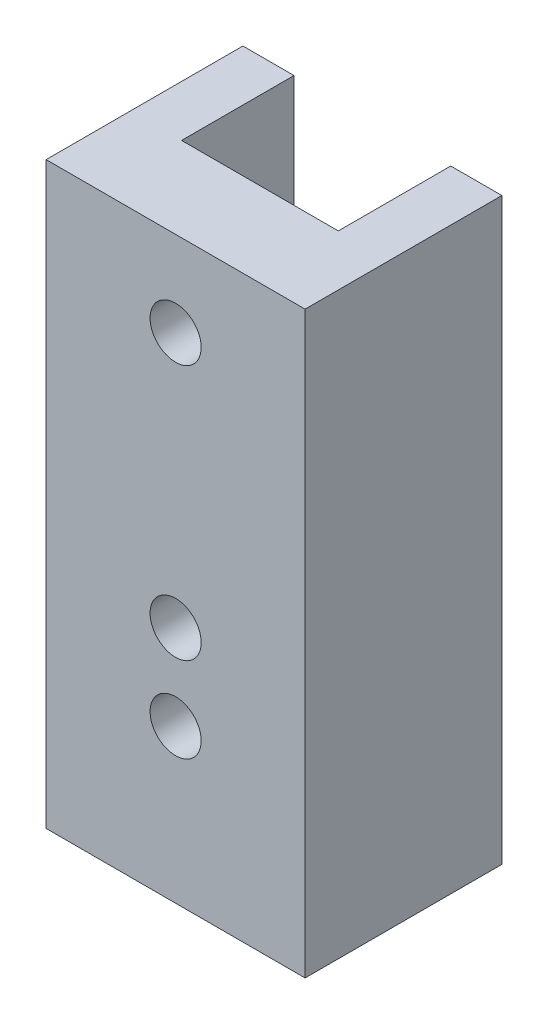
from build123d import *

# Parameters (mm, degrees)
BOSS_EXTRUDE1_DEPTH = 34
SKETCH2_R           = 1.5
CUT_EXTRUDE1_DEPTH  = 34
CUT_EXTRUDE2_DEPTH  = 10


with BuildPart() as part:
    # Sketch1 → Boss-Extrude1 (new body)
    with BuildSketch(Plane(origin=(0, 0, 0), x_dir=(1, 0, 0), z_dir=(0, 1, 0))):
        Polygon((7.6, 3.25), (4.6, 3.25), (4.6, -3.35), (-4.6, -3.35), (-4.6, 3.25), (-7.6, 3.25), (-7.6, -8.3), (0, -8.3), (7.6, -8.3), align=None)
    extrude(amount=BOSS_EXTRUDE1_DEPTH)

    # Sketch2 → Cut-Extrude1 (cut)
    with BuildSketch(Plane.XY.offset(8.3)):
        with Locations((0, 9)):
            Circle(SKETCH2_R)
        with Locations((0, 29)):
            Circle(SKETCH2_R)
    extrude(amount=-CUT_EXTRUDE1_DEPTH, mode=Mode.SUBTRACT)

    # Sketch3 → Cut-Extrude2 (cut)
    with BuildSketch(Plane.XY.offset(8.3)):
        with BuildLine():
            ThreePointArc((1.5, 14), (-1.060660172, 15.060660172), (0, 12.5))
            ThreePointArc((0, 12.5), (1.060660172, 12.939339828), (1.5, 14))
        make_face()
    extrude(amount=-CUT_EXTRUDE2_DEPTH, mode=Mode.SUBTRACT)


solid = part.part
